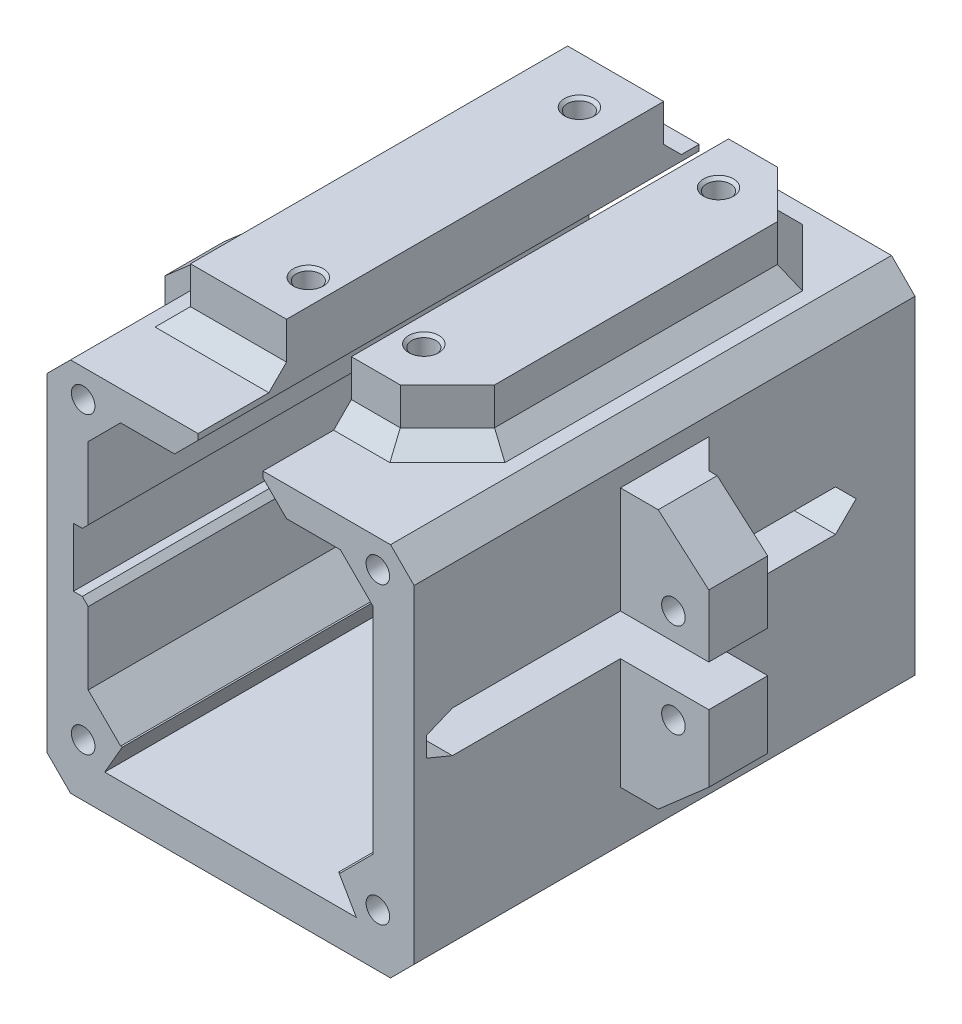
from build123d import *

# Parameters (mm, degrees)
BOSS_EXTRUDE1_DEPTH     = 100
BOSS_EXTRUDE2_DEPTH     = 100
CUT_EXTRUDE1_DEPTH      = 10
CHAMFER1_SIZE           = 5.5
CHAMFER2_SIZE           = 4
SKETCH8_R               = 2
BOSS_EXTRUDE3_DEPTH     = 9.3
CUT_EXTRUDE3_DEPTH      = 125.214315536
CUT_EXTRUDE3_DEPTH_BACK = 10
SKETCH9_W               = 11
SKETCH9_H               = 9.3
CHAMFER3_SIZE           = 4
CHAMFER4_SIZE           = 3
CHAMFER5_SIZE           = 3
SKETCH10_W              = 5
SKETCH10_H              = 10
CUT_EXTRUDE4_DEPTH      = 94
CHAMFER7_SIZE           = 1
CHAMFER8_SIZE           = 1
SKETCH11_R              = 2.05
CUT_EXTRUDE5_DEPTH      = 10
CHAMFER9_SIZE           = 0.5
SKETCH12_R              = 2
CUT_EXTRUDE6_DEPTH      = 30
BOSS_EXTRUDE6_START     = -2
BOSS_EXTRUDE6_DEPTH     = 10
SKETCH17_R              = 2
CUT_EXTRUDE7_DEPTH      = 17.1
SKETCH19_W              = 50
SKETCH19_H              = 7
CUT_EXTRUDE13_DEPTH     = 17.1
SKETCH20_W              = 62.3
SKETCH20_H              = 63.674798271
CUT_EXTRUDE14_DEPTH     = 15
CHAMFER10_SIZE          = 5
CHAMFER11_SIZE          = 2


with BuildPart() as part:
    # Sketch4 → Boss-Extrude1 (new body)
    with BuildSketch(Plane.XY):
        Polygon((-18.358738987, 4.974798271), (-27, 4.974798271), (-27, -6.2), (27, -6.2), (27, 4.974798271), (18.358738987, 4.974798271), (21.346410162, -0.2), (-21.346410162, -0.2), align=None)
    extrude(amount=BOSS_EXTRUDE1_DEPTH)

    # Sketch6 → Boss-Extrude2 (add)
    with BuildSketch(Plane.XY.offset(100)):
        Polygon((-24.15, 4.974798271), (-24.15, 52.474798271), (-5.5, 52.474798271), (-5.5, 57.474798271), (-31.15, 57.474798271), (-31.15, -6.2), (-24.15, -6.2), align=None)
        Polygon((24.15, -6.2), (24.15, 52.474798271), (5.5, 52.474798271), (5.5, 57.474798271), (31.15, 57.474798271), (31.15, -6.2), align=None)
    extrude(amount=-BOSS_EXTRUDE2_DEPTH)

    # Sketch7 → Cut-Extrude1 (cut)
    with BuildSketch(Plane(origin=(31.15, 0, 0), x_dir=(0, 0, -1), z_dir=(1, 0, 0))):
        Polygon((-85, 28.724798271), (-81.5, 25.224798271), (-13.5, 25.224798271), (-10, 28.724798271), (-13.5, 32.224798271), (-81.5, 32.224798271), align=None)
    extrude(amount=-CUT_EXTRUDE1_DEPTH, mode=Mode.SUBTRACT)

    # Chamfer1
    chamfer1_edges = [part.edges().sort_by_distance(p)[0] for p in [
        (-24.15, 52.474798271, 50),
        (-24.15, 4.974798271, 50),
        (24.15, 4.974798271, 50),
        (24.15, 52.474798271, 50),
    ]]
    chamfer(chamfer1_edges, length=CHAMFER1_SIZE)

    # Chamfer2
    chamfer2_edges = [part.edges().sort_by_distance(p)[0] for p in [
        (-5.5, 52.474798271, 50),
        (5.5, 52.474798271, 50),
    ]]
    chamfer(chamfer2_edges, length=CHAMFER2_SIZE)

    # Sketch8 → Boss-Extrude3 (add)
    with BuildSketch(Plane(origin=(0, 57.474798271, 0), x_dir=(1, 0, 0), z_dir=(0, 1, 0))):
        Polygon((-21.8, -70), (13.8, -70), (21.8, -62), (21.8, -14), (13.8, -6), (-21.8, -6), align=None)
        with Locations(Location((9.8, -62, 0), (0, 0, 270))):
            Circle(SKETCH8_R, mode=Mode.SUBTRACT)
        with Locations(Location((11.8, -14, 0), (0, 0, 270))):
            Circle(SKETCH8_R, mode=Mode.SUBTRACT)
        with Locations(Location((-11.8, -14, 0), (0, 0, 270))):
            Circle(SKETCH8_R, mode=Mode.SUBTRACT)
        with Locations(Location((-9.8, -62, 0), (0, 0, 270))):
            Circle(SKETCH8_R, mode=Mode.SUBTRACT)
    extrude(amount=BOSS_EXTRUDE3_DEPTH)

    # Sketch9 → Cut-Extrude3 (cut, two sides: drawn at the far end of the back side and taken through both)
    with BuildSketch(Plane.XY.offset(-CUT_EXTRUDE3_DEPTH_BACK)):
        with Locations((0, 62.124798271)):
            Rectangle(SKETCH9_W, SKETCH9_H)
    extrude(amount=CUT_EXTRUDE3_DEPTH + CUT_EXTRUDE3_DEPTH_BACK, mode=Mode.SUBTRACT)

    # Chamfer3
    chamfer3_edges = [part.edges().sort_by_distance(p)[0] for p in [
        (-31.15, -6.2, 50),
        (-31.15, 57.474798271, 50),
        (31.15, -6.2, 50),
        (31.15, 57.474798271, 50),
    ]]
    chamfer(chamfer3_edges, length=CHAMFER3_SIZE)

    # Chamfer4
    chamfer4_edges = [part.edges().sort_by_distance(p)[0] for p in [
        (9.65, 57.474798271, 70),
        (-21.8, 57.474798271, 38),
        (-13.65, 57.474798271, 70),
        (17.8, 57.474798271, 66),
        (21.8, 57.474798271, 38),
        (17.8, 57.474798271, 10),
        (9.65, 57.474798271, 6),
        (-13.65, 57.474798271, 6),
    ]]
    chamfer(chamfer4_edges, length=CHAMFER4_SIZE)

    # Chamfer5
    # the kernel refuses this chamfer: 3 mm, written as the material it adds along each edge
    with BuildSketch(Plane(origin=(31.15, 25.224798271, 81.5), x_dir=(0, -0.014760203742521738, -0.9998910622590239), z_dir=(-1, 0, 0)), Plane(origin=(31.15, 32.224798271, 81.5), x_dir=(0, -0.6965927104131427, 0.7174667907292097), z_dir=(-1, 0, 0))) as chamfer5_piece_1:
        Polygon((CHAMFER5_SIZE * 0.999891062259, -CHAMFER5_SIZE * 0.0147602037425), (-CHAMFER5_SIZE * 0.717466790729, -CHAMFER5_SIZE * 0.696592710413), (0, 0), align=None)
    extrude(amount=7)
    with BuildSketch(Plane(origin=(31.15, 28.724798271, 85), x_dir=(0, 0.7262819568766863, -0.687396915264661), z_dir=(-1, 0, 0))) as chamfer5_piece_2:
        Polygon((CHAMFER5_SIZE * 0.999621916911, CHAMFER5_SIZE * 0.0274958766106), (-CHAMFER5_SIZE * 0.0274958766106, CHAMFER5_SIZE * 0.999621916911), (0, 0), align=None)
    extrude(amount=7)

    # Sketch10 → Cut-Extrude4 (cut)
    with BuildSketch(Plane.XY.offset(100)):
        with Locations((-24.15, 28.724798271)):
            Rectangle(SKETCH10_W, SKETCH10_H)
    extrude(amount=-CUT_EXTRUDE4_DEPTH, mode=Mode.SUBTRACT)

    # Chamfer7
    chamfer7_edges = [part.edges().sort_by_distance(p)[0] for p in [
        (-24.15, 28.724798271, 6),
    ]]
    chamfer(chamfer7_edges, length=CHAMFER7_SIZE)

    # Chamfer8
    chamfer8_edges = [part.edges().sort_by_distance(p)[0] for p in [
        (-24.15, 23.724798271, 52.5),
        (-24.15, 33.724798271, 52.5),
    ]]
    chamfer(chamfer8_edges, length=CHAMFER8_SIZE)

    # Sketch11 → Cut-Extrude5 (cut)
    with BuildSketch(Plane(origin=(0, 66.774798271, 0), x_dir=(1, 0, 0), z_dir=(0, 1, 0))):
        with Locations(Location((-11.8, -14, 0), (0, 0, 270))):
            Circle(SKETCH11_R)
        with Locations(Location((11.8, -14, 0), (0, 0, 270))):
            Circle(SKETCH11_R)
        with Locations(Location((-9.8, -62, 0), (0, 0, 270))):
            Circle(SKETCH11_R)
        with Locations(Location((9.8, -62, 0), (0, 0, 270))):
            Circle(SKETCH11_R)
    extrude(amount=-CUT_EXTRUDE5_DEPTH, mode=Mode.SUBTRACT)

    # Chamfer9
    chamfer9_edges = [part.edges().sort_by_distance(p)[0] for p in [
        (11.8, 66.774798271, 11.95),
        (-9.8, 66.774798271, 59.95),
        (9.8, 66.774798271, 59.95),
        (-11.8, 66.774798271, 11.95),
    ]]
    chamfer(chamfer9_edges, length=CHAMFER9_SIZE)

    # Sketch12 → Cut-Extrude6 (cut)
    with BuildSketch(Plane.XY.offset(100)):
        with Locations((-25, 52.724798271)):
            Circle(SKETCH12_R)
        with Locations((25, 52.724798271)):
            Circle(SKETCH12_R)
        with Locations((-25, 2.724798271)):
            Circle(SKETCH12_R)
        with Locations((25, 2.724798271)):
            Circle(SKETCH12_R)
    extrude(amount=-CUT_EXTRUDE6_DEPTH, mode=Mode.SUBTRACT)

    # Sketch16 → Boss-Extrude6 (add)
    with BuildSketch(Plane(origin=(0, 0, 48), x_dir=(-1, 0, 0), z_dir=(0, 0, -1)).offset(BOSS_EXTRUDE6_START)):
        Polygon((-22, -0.675201729), (22, -0.675201729), (22, -9.250201729), (14.5, -17.825201729), (-14.5, -17.825201729), (-22, -9.250201729), align=None)
        Polygon((-29, 50.324798271), (-37.575, 50.324798271), (-46.15, 42.824798271), (-46.15, 13.824798271), (-37.575, 6.324798271), (-29, 6.324798271), align=None)
        Polygon((37.575, 6.324798271), (29, 6.324798271), (29, 50.324798271), (37.575, 50.324798271), (46.15, 42.824798271), (46.15, 13.824798271), align=None)
    extrude(amount=BOSS_EXTRUDE6_DEPTH)

    # Sketch17 → Cut-Extrude7 (cut)
    with BuildSketch(Plane.XY.offset(50)):
        with Locations((-40.15, 36.724798271)):
            Circle(SKETCH17_R)
        with Locations((-40.15, 20.724798271)):
            Circle(SKETCH17_R)
        with Locations(Location((40.15, 20.724798271, 0), (0, 0, 180))):
            Circle(SKETCH17_R)
        with Locations(Location((40.15, 36.724798271, 0), (0, 0, 180))):
            Circle(SKETCH17_R)
        with Locations((-8, -11.825201729)):
            Circle(SKETCH17_R)
        with Locations((8, -11.825201729)):
            Circle(SKETCH17_R)
    extrude(amount=-CUT_EXTRUDE7_DEPTH, mode=Mode.SUBTRACT)

    # Sketch19 → Cut-Extrude13 (cut)
    with BuildSketch(Plane(origin=(0, 0, 40), x_dir=(-1, 0, 0), z_dir=(0, 0, -1))):
        with Locations((-49.15, 28.724798271)):
            Rectangle(SKETCH19_W, SKETCH19_H)
    extrude(amount=-CUT_EXTRUDE13_DEPTH, mode=Mode.SUBTRACT)

    # Sketch20 → Cut-Extrude14 (cut)
    with BuildSketch(Plane.XY.offset(100)):
        with Locations((0, 25.637399136)):
            Rectangle(SKETCH20_W, SKETCH20_H)
    extrude(amount=-CUT_EXTRUDE14_DEPTH, mode=Mode.SUBTRACT)

    # Chamfer10
    chamfer10_edges = [part.edges().sort_by_distance(p)[0] for p in [
        (-31.15, 28.324798271, 40),
        (31.15, 41.274798271, 40),
        (31.15, 15.774798271, 40),
    ]]
    chamfer(chamfer10_edges, length=CHAMFER10_SIZE)

    # Chamfer11
    chamfer11_edges = [part.edges().sort_by_distance(p)[0] for p in [
        (0, -6.2, 40),
    ]]
    chamfer(chamfer11_edges, length=CHAMFER11_SIZE)


solid = part.part
